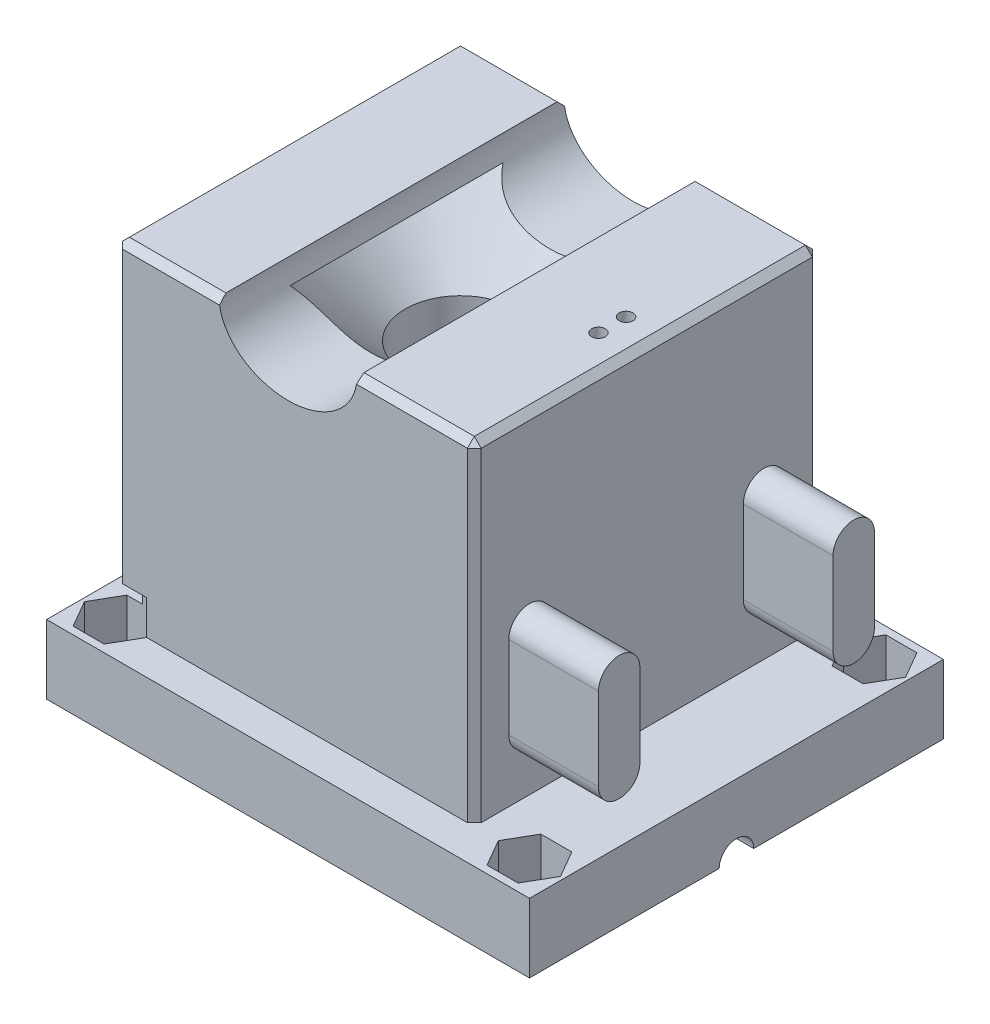
from build123d import *

# Parameters (mm, degrees)
SKETCH_1_W               = 70
SKETCH_1_H               = 60
EXTRUDE_1_DEPTH          = 58
SKETCH_2_W               = 44
SKETCH_2_H               = 42
CUT_EXTRUDE_1_DEPTH      = 35
SKETCH_3_W               = 70
SKETCH_3_H               = 60
SKETCH_3_W_2             = 52
SKETCH_3_H_2             = 50
CUT_EXTRUDE_3_DEPTH      = 48
SKETCH_4_R               = 8
CUT_EXTRUDE_4_DEPTH      = 75.087785768
SKETCH_5_RX              = 10
SKETCH_5_RY              = 8
CUT_EXTRUDE_5_DEPTH      = 88.258237433
SKETCH_6_R               = 8
CUT_EXTRUDE_6_DEPTH      = 10
CUT_EXTRUDE_6_DRAFT      = 45
EXTRUDE_2_DEPTH          = 5
EXTRUDE_3_DEPTH          = 13
SKETCH_11_R              = 1
CUT_EXTRUDE_7_DEPTH      = 58.879184514
CUT_EXTRUDE_8_REACH      = 97.729
SKETCH_13_R              = 2.5
CHAMFER_1_SIZE           = 1
CUT_EXTRUDE_9_DEPTH      = 5
CUT_EXTRUDE_9_DEPTH_BACK = 7
CUT_EXTRUDE_11_REACH     = 76.088
SKETCH_15_R              = 2


with BuildPart() as part:
    # 草图1 → 凸台-拉伸1 (new body)
    with BuildSketch(Plane(origin=(0, 0, 0), x_dir=(1, 0, 0), z_dir=(0, 1, 0))):
        Rectangle(SKETCH_1_W, SKETCH_1_H)
    extrude(amount=EXTRUDE_1_DEPTH)

    # 草图2 → 切除-拉伸1 (cut)
    with BuildSketch(Plane.XZ):
        with Locations((-4, 0)):
            Rectangle(SKETCH_2_W, SKETCH_2_H)
    extrude(amount=-CUT_EXTRUDE_1_DEPTH, mode=Mode.SUBTRACT)

    # 草图3 → 切除-拉伸3 (cut)
    with BuildSketch(Plane(origin=(0, 58, 0), x_dir=(1, 0, 0), z_dir=(0, 1, 0))):
        Rectangle(SKETCH_3_W, SKETCH_3_H)
        with Locations((-4, 0)):
            Rectangle(SKETCH_3_W_2, SKETCH_3_H_2, mode=Mode.SUBTRACT)
    extrude(amount=-CUT_EXTRUDE_3_DEPTH, mode=Mode.SUBTRACT)

    # 草图4 → 切除-拉伸4 (cut, through all)
    with BuildSketch(Plane(origin=(0, 58, 0), x_dir=(1, 0, 0), z_dir=(0, 1, 0))):
        with Locations(Location((-5, 0, 0), (0, 0, 270))):
            Circle(SKETCH_4_R)
    extrude(amount=-CUT_EXTRUDE_4_DEPTH, mode=Mode.SUBTRACT)

    # 草图5 → 切除-拉伸5 (cut, through all)
    with BuildSketch(Plane.XY.offset(25)):
        with Locations((-5, 58)):
            Ellipse(SKETCH_5_RX, SKETCH_5_RY)
    extrude(amount=-CUT_EXTRUDE_5_DEPTH, mode=Mode.SUBTRACT)


with BuildPart() as cut_extrude_6_tool:
    # 草图6 → 切除-拉伸6 (with draft: the straight prism first)
    with BuildSketch(Plane(origin=(0, 45, 0), x_dir=(-1, 0, 0), z_dir=(0, -1, 0))):
        with Locations(Location((5, 0, 0), (0, 0, 270))):
            Circle(SKETCH_6_R)
    extrude(amount=-CUT_EXTRUDE_6_DEPTH)
    # 切除-拉伸6: the draft: its side faces are tilted about the plane it starts from
    cut_extrude_6_sides = [cut_extrude_6_tool.faces().sort_by_distance(p)[0] for p in [
        (-5, 50, -8),
    ]]
    draft(cut_extrude_6_sides, Plane(origin=(0, 45, 0), x_dir=(-1, 0, 0), z_dir=(0, -1, 0)), CUT_EXTRUDE_6_DRAFT)


with BuildPart() as part_1:
    add(part.part)

    # 切除-拉伸6: cut by cut_extrude_6_tool
    add(cut_extrude_6_tool.part, mode=Mode.SUBTRACT)

    # 草图9 → 凸台-拉伸2 (add)
    with BuildSketch(Plane.ZY.offset(30)):
        with BuildLine():
            Line((-11, 31), (-11, 19))
            ThreePointArc((-11, 19), (-14, 16), (-17, 19))
            Line((-17, 19), (-17, 31))
            ThreePointArc((-17, 31), (-14, 34), (-11, 31))
        make_face()
        with BuildLine():
            Line((11, 31), (11, 19))
            ThreePointArc((11, 19), (14, 16), (17, 19))
            Line((17, 19), (17, 31))
            ThreePointArc((17, 31), (14, 34), (11, 31))
        make_face()
    extrude(amount=EXTRUDE_2_DEPTH)

    # 草图10 → 凸台-拉伸3 (add)
    with BuildSketch(Plane(origin=(22, 0, 0), x_dir=(0, 0, -1), z_dir=(1, 0, 0))):
        with BuildLine():
            Line((-14, 31), (-14, 19))
            ThreePointArc((-14, 19), (-17, 16), (-20, 19))
            Line((-20, 19), (-20, 31))
            ThreePointArc((-20, 31), (-17, 34), (-14, 31))
        make_face()
        with BuildLine():
            Line((14, 31), (14, 19))
            ThreePointArc((14, 19), (17, 16), (20, 19))
            Line((20, 19), (20, 31))
            ThreePointArc((20, 31), (17, 34), (14, 31))
        make_face()
    extrude(amount=EXTRUDE_3_DEPTH)

    # 草图11 → 切除-拉伸7 (cut, through all)
    with BuildSketch(Plane.XZ.offset(-35)):
        with Locations(Location((17, -2, 0), (0, 0, 270))):
            Circle(SKETCH_11_R)
        with Locations(Location((17, 2, 0), (0, 0, 270))):
            Circle(SKETCH_11_R)
    extrude(amount=-CUT_EXTRUDE_7_DEPTH, mode=Mode.SUBTRACT)

    # 草图13 → 切除-拉伸8 (cut, up to next)
    with BuildSketch(Plane(origin=(35, 0, 0), x_dir=(0, 0, -1), z_dir=(1, 0, 0)), mode=Mode.PRIVATE) as cut_extrude_8_sk1:
        Circle(SKETCH_13_R)
    cut_extrude_8_tool1 = extrude(cut_extrude_8_sk1.sketch, amount=-CUT_EXTRUDE_8_REACH, mode=Mode.PRIVATE) & part_1.part
    add(cut_extrude_8_tool1.solids().sort_by_distance((35, 0, 0))[0], mode=Mode.SUBTRACT)

    # 倒角1
    chamfer_1_edges = [part_1.edges().sort_by_distance(p)[0] for p in [
        (-30, 58, 0),
        (-22.5, 58, 25),
    ]]
    chamfer(chamfer_1_edges, length=CHAMFER_1_SIZE)

    # 倒角2
    # the kernel refuses this chamfer: 1 mm, written as the material it takes off along each edge
    with BuildSketch(Plane(origin=(21.333333333, 57.333333333, -24.333333333), x_dir=(-0.7071067811865475, 0, -0.7071067811865475), z_dir=(0.5773502691896258, 0.5773502691896258, -0.5773502691896258))) as chamfer_2_piece_1:
        Polygon((-0.707106781, -0.40824829), (0.707106781, -0.40824829), (0, 0.816496581), align=None)
    extrude(amount=1.270170592, mode=Mode.SUBTRACT)
    with BuildSketch(Plane(origin=(21.333333333, 57.333333333, 24.333333333), x_dir=(-0.7071067811865475, 0, 0.7071067811865475), z_dir=(0.5773502691896258, 0.5773502691896258, 0.5773502691896258))) as chamfer_2_piece_2:
        Polygon((-0.707106781, 0.40824829), (0.707106781, 0.40824829), (0, -0.816496581), align=None)
    extrude(amount=1.270170592, mode=Mode.SUBTRACT)
    with BuildSketch(Plane(origin=(-30, 59.571682988, -25), x_dir=(-0.027495876610585647, 0, 0.9996219169112968), z_dir=(0, -1, 0))) as chamfer_2_piece_3:
        with BuildLine():
            Line((1.028673195, 0), (-0.056547155, -1.027117794))
            Line((-0.056547155, -1.027117794), (-0.076539593, -1.026567876))
            ThreePointArc((-0.076539593, -1.026567876), (-0.034129227, -0.51339783), (-0.019992438, 0.000549918))
            Line((-0.019992438, 0.000549918), (0.000549918, 0.019992438))
            ThreePointArc((0.000549918, 0.019992438), (0.514497665, 0.00585565), (1.029223113, 0.019992438))
            Line((1.029223113, 0.019992438), (1.028673195, 0))
        make_face()
    extrude(amount=49.571682988, mode=Mode.SUBTRACT)
    with BuildSketch(Plane(origin=(-30, 59.571682988, 25), x_dir=(-0.027495876610585647, 0, -0.9996219169112968), z_dir=(0, -1, 0))) as chamfer_2_piece_4:
        with BuildLine():
            Line((1.028673195, 0), (-0.056547155, 1.027117794))
            Line((-0.056547155, 1.027117794), (-0.076539593, 1.026567876))
            ThreePointArc((-0.076539593, 1.026567876), (-0.034129227, 0.51339783), (-0.019992438, -0.000549918))
            Line((-0.019992438, -0.000549918), (0.000549918, -0.019992438))
            ThreePointArc((0.000549918, -0.019992438), (0.514497665, -0.00585565), (1.029223113, -0.019992438))
            Line((1.029223113, -0.019992438), (1.028673195, 0))
        make_face()
    extrude(amount=49.571682988, mode=Mode.SUBTRACT)
    with BuildSketch(Plane(origin=(22, 60.571682988, -25), x_dir=(-0.9996219169112968, 0, -0.027495876610585647), z_dir=(0, -1, 0))) as chamfer_2_piece_5:
        with BuildLine():
            Line((1.028673195, 0), (-0.056547155, -1.027117794))
            Line((-0.056547155, -1.027117794), (-0.076539593, -1.026567876))
            ThreePointArc((-0.076539593, -1.026567876), (-0.034129227, -0.51339783), (-0.019992438, 0.000549918))
            Line((-0.019992438, 0.000549918), (0.000549918, 0.019992438))
            ThreePointArc((0.000549918, 0.019992438), (0.514497665, 0.00585565), (1.029223113, 0.019992438))
            Line((1.029223113, 0.019992438), (1.028673195, 0))
        make_face()
    extrude(amount=50.571682988, mode=Mode.SUBTRACT)
    with BuildSketch(Plane(origin=(22, 60.571682988, 25), x_dir=(-0.9996219169112968, 0, 0.027495876610585647), z_dir=(0, -1, 0))) as chamfer_2_piece_6:
        with BuildLine():
            Line((1.028673195, 0), (-0.056547155, 1.027117794))
            Line((-0.056547155, 1.027117794), (-0.076539593, 1.026567876))
            ThreePointArc((-0.076539593, 1.026567876), (-0.034129227, 0.51339783), (-0.019992438, -0.000549918))
            Line((-0.019992438, -0.000549918), (0.000549918, -0.019992438))
            ThreePointArc((0.000549918, -0.019992438), (0.514497665, -0.00585565), (1.029223113, -0.019992438))
            Line((1.029223113, -0.019992438), (1.028673195, 0))
        make_face()
    extrude(amount=50.571682988, mode=Mode.SUBTRACT)
    with BuildSketch(Plane(origin=(24.571682988, 58, 25), x_dir=(0, -0.9996219169112968, 0.02749587661058555), z_dir=(-1, 0, 0)), Plane(origin=(2.428317012, 58, -25), x_dir=(0, -0.9996219169112968, -0.02749587661058555), z_dir=(1, 0, 0))) as chamfer_2_piece_7:
        with BuildLine():
            Line((1.028673195, 0), (-0.056547155, -1.027117794))
            Line((-0.056547155, -1.027117794), (-0.076539593, -1.026567876))
            ThreePointArc((-0.076539593, -1.026567876), (-0.034129227, -0.51339783), (-0.019992438, 0.000549918))
            Line((-0.019992438, 0.000549918), (0.000549918, 0.019992438))
            ThreePointArc((0.000549918, 0.019992438), (0.514497665, 0.00585565), (1.029223113, 0.019992438))
            Line((1.029223113, 0.019992438), (1.028673195, 0))
        make_face()
    extrude(amount=22.143365976, mode=Mode.SUBTRACT)
    with BuildSketch(Plane(origin=(22, 58, -27.571682988), x_dir=(-0.9996219169112968, 0.0274958766105891, 0), z_dir=(0, 0, 1))) as chamfer_2_piece_8:
        with BuildLine():
            Line((1.028673195, 0), (-0.056547155, 1.027117794))
            Line((-0.056547155, 1.027117794), (-0.076539593, 1.026567876))
            ThreePointArc((-0.076539593, 1.026567876), (-0.034129227, 0.51339783), (-0.019992438, -0.000549918))
            Line((-0.019992438, -0.000549918), (0.000549918, -0.019992438))
            ThreePointArc((0.000549918, -0.019992438), (0.514497665, -0.00585565), (1.029223113, -0.019992438))
            Line((1.029223113, -0.019992438), (1.028673195, 0))
        make_face()
    extrude(amount=55.143365976, mode=Mode.SUBTRACT)
    with BuildSketch(Plane(origin=(-31.571682988, 58, -25), x_dir=(0, -0.9996219169112968, -0.02749587661058555), z_dir=(1, 0, 0))) as chamfer_2_piece_9:
        with BuildLine():
            Line((1.028673195, 0), (-0.056547155, -1.027117794))
            Line((-0.056547155, -1.027117794), (-0.076539593, -1.026567876))
            ThreePointArc((-0.076539593, -1.026567876), (-0.034129227, -0.51339783), (-0.019992438, 0.000549918))
            Line((-0.019992438, 0.000549918), (0.000549918, 0.019992438))
            ThreePointArc((0.000549918, 0.019992438), (0.514497665, 0.00585565), (1.029223113, 0.019992438))
            Line((1.029223113, 0.019992438), (1.028673195, 0))
        make_face()
    extrude(amount=19.143365976, mode=Mode.SUBTRACT)

    # 草图14 → 切除-拉伸9 (cut, two sides: drawn at the far end of the back side and taken through both)
    with BuildSketch(Plane(origin=(0, 10, 0), x_dir=(1, 0, 0), z_dir=(0, 1, 0)).offset(-CUT_EXTRUDE_9_DEPTH_BACK)):
        Polygon((25.5, 25.010316584), (27.75, 28.907430901), (32.25, 28.907430901), (34.5, 25.010316584), (32.25, 21.113202267), (27.75, 21.113202267), align=None)
        Polygon((-27.75, 21.113202267), (-25.5, 25.010316584), (-27.75, 28.907430901), (-32.25, 28.907430901), (-34.5, 25.010316584), (-32.25, 21.113202267), align=None)
        Polygon((27.75, -28.907430901), (32.25, -28.907430901), (34.5, -25.010316584), (32.25, -21.113202267), (27.75, -21.113202267), (25.5, -25.010316584), align=None)
        Polygon((-32.25, -21.113202267), (-27.75, -21.113202267), (-25.5, -25.010316584), (-27.75, -28.907430901), (-32.25, -28.907430901), (-34.5, -25.010316584), align=None)
    extrude(amount=CUT_EXTRUDE_9_DEPTH + CUT_EXTRUDE_9_DEPTH_BACK, mode=Mode.SUBTRACT)

    # 草图15 → 切除-拉伸11 (cut, up to next)
    with BuildSketch(Plane.XZ, mode=Mode.PRIVATE) as cut_extrude_11_sk1:
        with Locations(Location((-30, 25, 0), (0, 0, 270))):
            Circle(SKETCH_15_R)
    cut_extrude_11_tool1 = extrude(cut_extrude_11_sk1.sketch, amount=-CUT_EXTRUDE_11_REACH, mode=Mode.PRIVATE) & part_1.part
    # 草图15 → 切除-拉伸11 (cut, up to next)
    with BuildSketch(Plane.XZ, mode=Mode.PRIVATE) as cut_extrude_11_sk2:
        with Locations(Location((30, 25, 0), (0, 0, 270))):
            Circle(SKETCH_15_R)
    cut_extrude_11_tool2 = extrude(cut_extrude_11_sk2.sketch, amount=-CUT_EXTRUDE_11_REACH, mode=Mode.PRIVATE) & part_1.part
    # 草图15 → 切除-拉伸11 (cut, up to next)
    with BuildSketch(Plane.XZ, mode=Mode.PRIVATE) as cut_extrude_11_sk3:
        with Locations(Location((30, -25, 0), (0, 0, 270))):
            Circle(SKETCH_15_R)
    cut_extrude_11_tool3 = extrude(cut_extrude_11_sk3.sketch, amount=-CUT_EXTRUDE_11_REACH, mode=Mode.PRIVATE) & part_1.part
    # 草图15 → 切除-拉伸11 (cut, up to next)
    with BuildSketch(Plane.XZ, mode=Mode.PRIVATE) as cut_extrude_11_sk4:
        with Locations(Location((-30, -25, 0), (0, 0, 90))):
            Circle(SKETCH_15_R)
    cut_extrude_11_tool4 = extrude(cut_extrude_11_sk4.sketch, amount=-CUT_EXTRUDE_11_REACH, mode=Mode.PRIVATE) & part_1.part
    add(cut_extrude_11_tool1.solids().sort_by_distance((-30, 0, 25))[0], mode=Mode.SUBTRACT)
    add(cut_extrude_11_tool2.solids().sort_by_distance((30, 0, 25))[0], mode=Mode.SUBTRACT)
    add(cut_extrude_11_tool3.solids().sort_by_distance((30, 0, -25))[0], mode=Mode.SUBTRACT)
    add(cut_extrude_11_tool4.solids().sort_by_distance((-30, 0, -25))[0], mode=Mode.SUBTRACT)


solid = part_1.part
